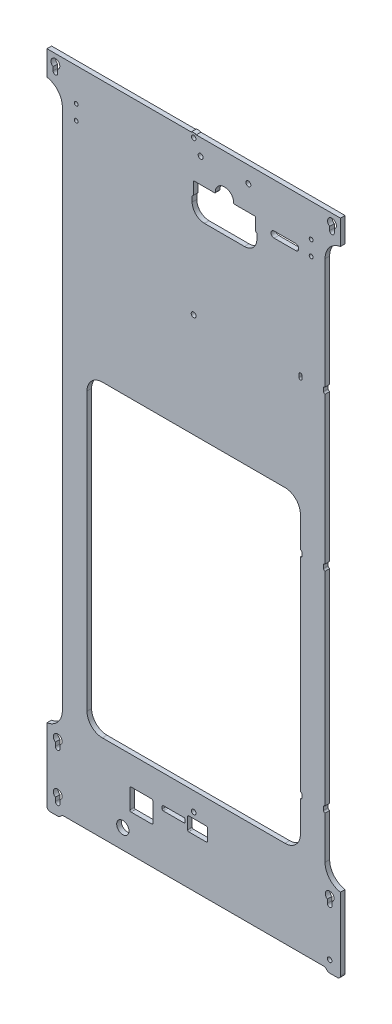
from build123d import *

# Parameters (mm, degrees)
SKETCH1_R           = 1.5
BOSS_EXTRUDE1_DEPTH = 3
SKETCH2_W           = 10
SKETCH2_H           = 363
CUT_EXTRUDE1_DEPTH  = 401.99329533
FILLET1_R           = 12
SKETCH3_R           = 1.5
CUT_EXTRUDE2_DEPTH  = 401.99329533
SKETCH4_W           = 138.54
SKETCH4_H           = 200
CUT_EXTRUDE3_DEPTH  = 401.99329533
FILLET2_R           = 10
SKETCH5_W           = 15
SKETCH5_H           = 14.1
SKETCH5_H_2         = 3
SKETCH5_W_2         = 13
SKETCH5_H_3         = 9
CUT_EXTRUDE4_DEPTH  = 401.99329533
FILLET3_R           = 0.8
SKETCH6_R           = 4
CUT_EXTRUDE5_DEPTH  = 401.99329533
SKETCH8_R           = 1.6
CUT_EXTRUDE7_DEPTH  = 401.99329533
FILLET4_R           = 0.4
BOSS_EXTRUDE2_DEPTH = 3
SKETCH10_R          = 1.25
CUT_EXTRUDE8_DEPTH  = 402.478981891
CUT_EXTRUDE9_DEPTH  = 402.478981891
FILLET5_R           = 2


with BuildPart() as part:
    # Sketch1 → Boss-Extrude1 (new body)
    with BuildSketch(Plane.XY):
        Polygon((95.27, 389.5), (-95.27, 389.5), (-95.27, -36.5), (-95.27, -38.5), (-87.27, -38.5), (-85.27, -36.5), (85.27, -36.5), (87.27, -38.5), (95.27, -38.5), (95.27, -36.5), align=None)
        with Locations((88.27, -31)):
            Circle(SKETCH1_R, mode=Mode.SUBTRACT)
        with BuildLine():
            Line((-89.77, -31), (-89.77, -28.576675837))
            ThreePointArc((-89.77, -28.576675837), (-88.27, -23.303351674), (-86.77, -28.576675837))
            Line((-86.77, -28.576675837), (-86.77, -31))
            ThreePointArc((-86.77, -31), (-88.27, -32.5), (-89.77, -31))
        make_face(mode=Mode.SUBTRACT)
        with BuildLine():
            Line((-89.77, 0), (-89.77, 2.423324163))
            ThreePointArc((-89.77, 2.423324163), (-88.27, 7.696648326), (-86.77, 2.423324163))
            Line((-86.77, 2.423324163), (-86.77, 0))
            ThreePointArc((-86.77, 0), (-88.27, -1.5), (-89.77, 0))
        make_face(mode=Mode.SUBTRACT)
        with BuildLine():
            Line((86.77, 0), (86.77, 2.423324163))
            ThreePointArc((86.77, 2.423324163), (88.27, 7.696648326), (89.77, 2.423324163))
            Line((89.77, 2.423324163), (89.77, 0))
            ThreePointArc((89.77, 0), (88.27, -1.5), (86.77, 0))
        make_face(mode=Mode.SUBTRACT)
        with BuildLine():
            Line((88.27, 379), (88.27, 381.423324163))
            ThreePointArc((88.27, 381.423324163), (89.77, 386.696648326), (91.27, 381.423324163))
            Line((91.27, 381.423324163), (91.27, 379))
            ThreePointArc((91.27, 379), (89.77, 377.5), (88.27, 379))
        make_face(mode=Mode.SUBTRACT)
        with BuildLine():
            Line((-91.27, 379), (-91.27, 381.423324163))
            ThreePointArc((-91.27, 381.423324163), (-89.77, 386.696648326), (-88.27, 381.423324163))
            Line((-88.27, 381.423324163), (-88.27, 379))
            ThreePointArc((-88.27, 379), (-89.77, 377.5), (-91.27, 379))
        make_face(mode=Mode.SUBTRACT)
    extrude(amount=BOSS_EXTRUDE1_DEPTH)

    # Sketch2 → Cut-Extrude1 (cut, through all)
    with BuildSketch(Plane.XY.offset(3)):
        with Locations((-90.27, 192)):
            Rectangle(SKETCH2_W, SKETCH2_H)
        with Locations((90.27, 192)):
            Rectangle(SKETCH2_W, SKETCH2_H)
    extrude(amount=-CUT_EXTRUDE1_DEPTH, mode=Mode.SUBTRACT)

    # Fillet1
    # the kernel refuses this fillet: 12 mm, written as the material it adds along each edge
    with BuildSketch(Plane(origin=(85.27, 10.5, 3), x_dir=(0, 1, 0), z_dir=(0, 0, -1))) as fillet1_piece_1:
        with BuildLine():
            CenterArc((11.832159566, 12), FILLET1_R, 189.594068227, 80.405931773)
            Line((0, 10), (-0.236643191, 9.96))
            ThreePointArc((-0.236643191, 9.96), (-0.24, 5), (-0.24, 0))
            Line((-0.24, 0), (0, -0.24))
            Line((0, -0.24), (11.832159566, -0.24))
            Line((11.832159566, -0.24), (11.832159566, 0))
        make_face()
    extrude(amount=3)
    with BuildSketch(Plane(origin=(-85.27, 10.5, 3), x_dir=(-1, 0, 0), z_dir=(0, 0, -1)), Plane(origin=(85.27, 373.5, 3), x_dir=(1, 0, 0), z_dir=(0, 0, -1))) as fillet1_piece_2:
        with BuildLine():
            CenterArc((12, 11.832159566), FILLET1_R, 180, 80.405931773)
            Line((0, 11.832159566), (-0.24, 11.832159566))
            Line((-0.24, 11.832159566), (-0.24, 0))
            Line((-0.24, 0), (0, -0.24))
            ThreePointArc((0, -0.24), (5, -0.24), (9.96, -0.236643191))
            Line((9.96, -0.236643191), (10, 0))
        make_face()
    extrude(amount=3)
    with BuildSketch(Plane(origin=(-85.27, 373.5, 3), x_dir=(-1, 0, 0), z_dir=(0, 0, -1))) as fillet1_piece_3:
        with BuildLine():
            CenterArc((12, -11.832159566), FILLET1_R, 99.594068227, 80.405931773)
            Line((0, -11.832159566), (-0.24, -11.832159566))
            Line((-0.24, -11.832159566), (-0.24, 0))
            Line((-0.24, 0), (0, 0.24))
            ThreePointArc((0, 0.24), (5, 0.24), (9.96, 0.236643191))
            Line((9.96, 0.236643191), (10, 0))
        make_face()
    extrude(amount=3)

    # Sketch3 → Cut-Extrude2 (cut, through all)
    with BuildSketch(Plane.XY.offset(3)):
        with Locations((0, 8)):
            Circle(SKETCH3_R)
        with Locations((0, 387)):
            Circle(SKETCH3_R)
    extrude(amount=-CUT_EXTRUDE2_DEPTH, mode=Mode.SUBTRACT)

    # Sketch4 → Cut-Extrude3 (cut, through all)
    with BuildSketch(Plane.XY.offset(3)):
        with Locations((0, 120)):
            Rectangle(SKETCH4_W, SKETCH4_H)
    extrude(amount=-CUT_EXTRUDE3_DEPTH, mode=Mode.SUBTRACT)

    # Fillet2
    fillet2_edges = [part.edges().sort_by_distance(p)[0] for p in [
        (69.27, 220, 1.5),
        (69.27, 20, 1.5),
        (-69.27, 20, 1.5),
        (-69.27, 220, 1.5),
    ]]
    fillet(fillet2_edges, radius=FILLET2_R)

    # Sketch5 → Cut-Extrude4 (cut, through all)
    with BuildSketch(Plane.XY.offset(3)):
        with Locations((-34, -5.35)):
            Rectangle(SKETCH5_W, SKETCH5_H)
        with Locations((-13, 0.2)):
            Rectangle(SKETCH5_W, SKETCH5_H_2)
        with Locations((2.5, -0.3)):
            Rectangle(SKETCH5_W_2, SKETCH5_H_3)
    extrude(amount=-CUT_EXTRUDE4_DEPTH, mode=Mode.SUBTRACT)

    # Fillet3
    fillet3_edges = [part.edges().sort_by_distance(p)[0] for p in [
        (-41.5, -12.4, 1.5),
        (-41.5, 1.7, 1.5),
        (-26.5, 1.7, 1.5),
        (-26.5, -12.4, 1.5),
        (-20.5, -1.3, 1.5),
        (-20.5, 1.7, 1.5),
        (-5.5, 1.7, 1.5),
        (-5.5, -1.3, 1.5),
        (-4, -4.8, 1.5),
        (-4, 4.2, 1.5),
        (9, 4.2, 1.5),
        (9, -4.8, 1.5),
    ]]
    fillet(fillet3_edges, radius=FILLET3_R)

    # Sketch6 → Cut-Extrude5 (cut, through all)
    with BuildSketch(Plane.XY.offset(3)):
        with Locations((-46, -23.8)):
            Circle(SKETCH6_R)
    extrude(amount=-CUT_EXTRUDE5_DEPTH, mode=Mode.SUBTRACT)

    # Sketch8 → Cut-Extrude7 (cut, through all)
    with BuildSketch(Plane.XY.offset(3)):
        with Locations((4.5, 378.9)):
            Circle(SKETCH8_R)
        with Locations((35.5, 378.9)):
            Circle(SKETCH8_R)
        with Locations((0, 287.5)):
            Circle(SKETCH8_R)
        with BuildLine():
            Line((7, 342.4), (33, 342.4))
            ThreePointArc((33, 342.4), (38.656854249, 344.743145751), (41, 350.4))
            Line((41, 350.4), (41, 353.775))
            Line((41, 353.775), (40.2, 354.575))
            Line((40.2, 354.575), (40.2, 362.875))
            Line((40.2, 362.875), (26, 362.875))
            Line((26, 362.875), (26, 363.4))
            ThreePointArc((26, 363.4), (20, 369.4), (14, 363.4))
            Line((14, 363.4), (14, 362.875))
            Line((14, 362.875), (-0.2, 362.875))
            Line((-0.2, 362.875), (-0.2, 354.575))
            Line((-0.2, 354.575), (-1, 353.775))
            Line((-1, 353.775), (-1, 350.4))
            ThreePointArc((-1, 350.4), (1.343145751, 344.743145751), (7, 342.4))
        make_face()
        with BuildLine():
            Line((52.2, 360.725), (66.2, 360.725))
            ThreePointArc((66.2, 360.725), (68.2, 358.725), (66.2, 356.725))
            Line((66.2, 356.725), (52.2, 356.725))
            ThreePointArc((52.2, 356.725), (50.2, 358.725), (52.2, 360.725))
        make_face()
    extrude(amount=-CUT_EXTRUDE7_DEPTH, mode=Mode.SUBTRACT)

    # Fillet4
    fillet4_edges = [part.edges().sort_by_distance(p)[0] for p in [
        (-0.2, 362.875, 1.5),
        (14, 362.875, 1.5),
        (26, 362.875, 1.5),
        (40.2, 362.875, 1.5),
    ]]
    fillet(fillet4_edges, radius=FILLET4_R)

    # Sketch9 → Boss-Extrude2 (add)
    with BuildSketch(Plane.XY.offset(3)):
        with BuildLine():
            Line((-1.658312395, 389.5), (1.658312395, 389.5))
            ThreePointArc((1.658312395, 389.5), (0, 390), (-1.658312395, 389.5))
        make_face()
    extrude(amount=-BOSS_EXTRUDE2_DEPTH)

    # Sketch10 → Cut-Extrude8 (cut, through all)
    with BuildSketch(Plane.XY.offset(3)):
        with Locations((-76.27, 368)):
            Circle(SKETCH10_R)
        with Locations((-76.27, 358.5)):
            Circle(SKETCH10_R)
        with Locations((76.27, 368)):
            Circle(SKETCH10_R)
        with Locations((76.27, 358.5)):
            Circle(SKETCH10_R)
    extrude(amount=-CUT_EXTRUDE8_DEPTH, mode=Mode.SUBTRACT)

    # Sketch11 → Cut-Extrude9 (cut, through all)
    with BuildSketch(Plane.XY.offset(3)):
        with BuildLine():
            Line((86.27, 189), (86.27, 187))
            ThreePointArc((86.27, 187), (85.27, 186), (84.27, 187))
            Line((84.27, 187), (84.27, 189))
            ThreePointArc((84.27, 189), (85.27, 190), (86.27, 189))
        make_face()
        with BuildLine():
            Line((70.27, 189), (70.27, 187))
            ThreePointArc((70.27, 187), (69.27, 186), (68.27, 187))
            Line((68.27, 187), (68.27, 189))
            ThreePointArc((68.27, 189), (69.27, 190), (70.27, 189))
        make_face()
        with BuildLine():
            Line((86.27, 288.5), (86.27, 286.5))
            ThreePointArc((86.27, 286.5), (85.27, 285.5), (84.27, 286.5))
            Line((84.27, 286.5), (84.27, 288.5))
            ThreePointArc((84.27, 288.5), (85.27, 289.5), (86.27, 288.5))
        make_face()
        with BuildLine():
            Line((70.27, 288.5), (70.27, 286.5))
            ThreePointArc((70.27, 286.5), (69.27, 285.5), (68.27, 286.5))
            Line((68.27, 286.5), (68.27, 288.5))
            ThreePointArc((68.27, 288.5), (69.27, 289.5), (70.27, 288.5))
        make_face()
        with BuildLine():
            Line((86.27, 53), (86.27, 51))
            ThreePointArc((86.27, 51), (85.27, 50), (84.27, 51))
            Line((84.27, 51), (84.27, 53))
            ThreePointArc((84.27, 53), (85.27, 54), (86.27, 53))
        make_face()
        with BuildLine():
            Line((70.27, 53), (70.27, 51))
            ThreePointArc((70.27, 51), (69.27, 50), (68.27, 51))
            Line((68.27, 51), (68.27, 53))
            ThreePointArc((68.27, 53), (69.27, 54), (70.27, 53))
        make_face()
    extrude(amount=-CUT_EXTRUDE9_DEPTH, mode=Mode.SUBTRACT)

    # Fillet5
    fillet5_edges = [part.edges().sort_by_distance(p)[0] for p in [
        (95.27, -38.5, 1.5),
        (87.27, -38.5, 1.5),
        (85.27, -36.5, 1.5),
        (-85.27, -36.5, 1.5),
        (-87.27, -38.5, 1.5),
        (-95.27, -38.5, 1.5),
    ]]
    fillet(fillet5_edges, radius=FILLET5_R)


solid = part.part
